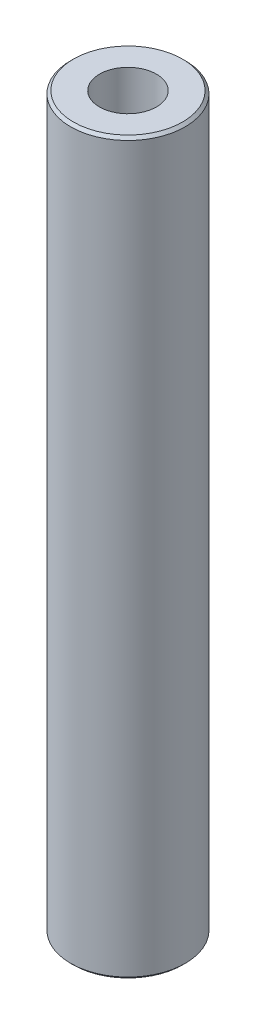
from build123d import *

# Parameters (mm, degrees)
SKETCH1_R           = 20
BOSS_EXTRUDE1_DEPTH = 254.747592865
SKETCH2_R           = 9.937901976
CUT_EXTRUDE1_DEPTH  = 257.312965085
CHAMFER1_SIZE       = 0.964064729


with BuildPart() as part:
    # Sketch1 → Boss-Extrude1 (new body)
    with BuildSketch(Plane(origin=(0, 0, 0), x_dir=(1, 0, 0), z_dir=(0, 1, 0))):
        Circle(SKETCH1_R)
    extrude(amount=BOSS_EXTRUDE1_DEPTH)

    # Sketch2 → Cut-Extrude1 (cut, through all)
    with BuildSketch(Plane(origin=(0, 0, 0), x_dir=(1, 0, 0), z_dir=(0, 1, 0))):
        Circle(SKETCH2_R)
    extrude(amount=CUT_EXTRUDE1_DEPTH, mode=Mode.SUBTRACT)

    # Chamfer1
    chamfer1_edges = [part.edges().sort_by_distance(p)[0] for p in [
        (-20, 254.747592865, 0),
        (-20, 0, 0),
    ]]
    chamfer(chamfer1_edges, length=CHAMFER1_SIZE)


solid = part.part
